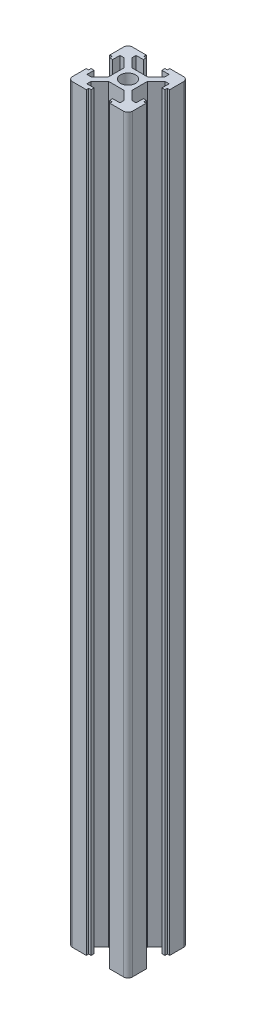
from build123d import *

# Parameters (mm, degrees)
BOSS_EXTRUDE1_DEPTH = 250


with BuildPart() as part:
    # Sketch1 → Boss-Extrude1 (new body)
    with BuildSketch(Plane(origin=(0, 0, 0), x_dir=(1, 0, 0), z_dir=(0, 1, 0))):
        with BuildLine():
            Line((8.5, 10), (3.9, 10))
            Line((3.9, 10), (3.9, 9.2))
            Line((3.9, 9.2), (3.1, 9.2))
            Line((3.1, 9.2), (3.1, 8.2))
            Line((3.1, 8.2), (5.5, 8.2))
            Line((5.5, 8.2), (5.5, 6.77))
            Line((5.5, 6.77), (2.63, 3.9))
            Line((2.63, 3.9), (2.549104946, 3.9))
            Line((2.549104946, 3.9), (0, 3.9))
            Line((0, 3.9), (-2.63, 3.9))
            Line((-2.63, 3.9), (-5.5, 6.77))
            Line((-5.5, 6.77), (-5.5, 8.2))
            Line((-5.5, 8.2), (-3.1, 8.2))
            Line((-3.1, 8.2), (-3.1, 9.2))
            Line((-3.1, 9.2), (-3.9, 9.2))
            Line((-3.9, 9.2), (-3.9, 10))
            Line((-3.9, 10), (-8.5, 10))
            ThreePointArc((-8.5, 10), (-9.560660172, 9.560660172), (-10, 8.5))
            Line((-10, 8.5), (-10, 3.9))
            Line((-10, 3.9), (-9.2, 3.9))
            Line((-9.2, 3.9), (-9.2, 3.1))
            Line((-9.2, 3.1), (-8.2, 3.1))
            Line((-8.2, 3.1), (-8.2, 5.5))
            Line((-8.2, 5.5), (-6.77, 5.5))
            Line((-6.77, 5.5), (-3.9, 2.63))
            Line((-3.9, 2.63), (-3.9, 0))
            Line((-3.9, 0), (-3.9, -2.63))
            Line((-3.9, -2.63), (-6.77, -5.5))
            Line((-6.77, -5.5), (-8.2, -5.5))
            Line((-8.2, -5.5), (-8.2, -3.1))
            Line((-8.2, -3.1), (-9.2, -3.1))
            Line((-9.2, -3.1), (-9.2, -3.9))
            Line((-9.2, -3.9), (-10, -3.9))
            Line((-10, -3.9), (-10, -8.5))
            ThreePointArc((-10, -8.5), (-9.560660172, -9.560660172), (-8.5, -10))
            Line((-8.5, -10), (-3.9, -10))
            Line((-3.9, -10), (-3.9, -9.2))
            Line((-3.9, -9.2), (-3.1, -9.2))
            Line((-3.1, -9.2), (-3.1, -8.2))
            Line((-3.1, -8.2), (-5.5, -8.2))
            Line((-5.5, -8.2), (-5.5, -6.77))
            Line((-5.5, -6.77), (-2.63, -3.9))
            Line((-2.63, -3.9), (0, -3.9))
            Line((0, -3.9), (2.63, -3.9))
            Line((2.63, -3.9), (5.5, -6.77))
            Line((5.5, -6.77), (5.5, -8.2))
            Line((5.5, -8.2), (3.1, -8.2))
            Line((3.1, -8.2), (3.1, -9.2))
            Line((3.1, -9.2), (3.9, -9.2))
            Line((3.9, -9.2), (3.9, -10))
            Line((3.9, -10), (8.5, -10))
            ThreePointArc((8.5, -10), (9.560660172, -9.560660172), (10, -8.5))
            Line((10, -8.5), (10, -3.9))
            Line((10, -3.9), (9.2, -3.9))
            Line((9.2, -3.9), (9.2, -3.1))
            Line((9.2, -3.1), (8.2, -3.1))
            Line((8.2, -3.1), (8.2, -5.5))
            Line((8.2, -5.5), (6.77, -5.5))
            Line((6.77, -5.5), (3.9, -2.63))
            Line((3.9, -2.63), (3.9, 0))
            Line((3.9, 0), (3.9, 2.63))
            Line((3.9, 2.63), (6.77, 5.5))
            Line((6.77, 5.5), (8.2, 5.5))
            Line((8.2, 5.5), (8.2, 3.1))
            Line((8.2, 3.1), (9.2, 3.1))
            Line((9.2, 3.1), (9.2, 3.9))
            Line((9.2, 3.9), (10, 3.9))
            Line((10, 3.9), (10, 8.5))
            ThreePointArc((10, 8.5), (9.560660172, 9.560660172), (8.5, 10))
        make_face()
        with BuildLine():
            ThreePointArc((0, 2.5), (1.767766953, 1.767766953), (2.5, 0))
            ThreePointArc((2.5, 0), (-1.767766953, -1.767766953), (0, 2.5))
        make_face(mode=Mode.SUBTRACT)
    extrude(amount=BOSS_EXTRUDE1_DEPTH)


solid = part.part
